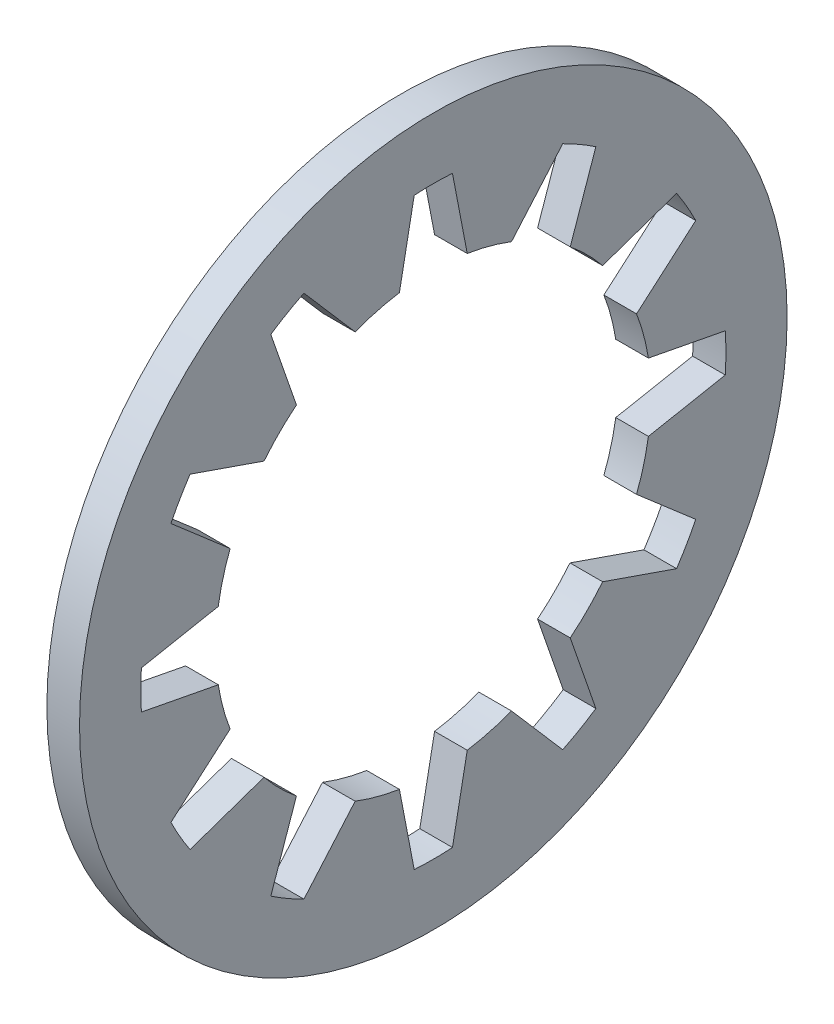
from build123d import *

# Parameters (mm, degrees)
SECSKE_W      = 1.2
SECSKE_H      = 5
INTCUT_DEPTH  = 19.423897525
INTCUTS_COUNT = 12
INTCUTS_ANGLE = 330


with BuildPart() as part:
    # SecSke → Body (revolve)
    with BuildSketch(Plane.XY):
        with Locations((-0.6, 10.5)):
            Rectangle(SECSKE_W, SECSKE_H)
    revolve(axis=Axis((-34.925, 0, 0), (1, 0, 0)))

    # IntCutSke → IntCut (cut, through all)
    with BuildSketch(Plane(origin=(0, 0, 0), x_dir=(0, 0, -1), z_dir=(1, 0, 0))):
        with BuildLine():
            Line((-0.703083639, 10.726983425), (-1.326257139, 7.483384395))
            ThreePointArc((-1.326257139, 7.483384395), (0, 7.6), (1.326257139, 7.483384395))
            Line((1.326257139, 7.483384395), (0.703083639, 10.726983425))
            ThreePointArc((0.703083639, 10.726983425), (0, 10.75), (-0.703083639, 10.726983425))
        make_face()
    intcut = extrude(amount=-INTCUT_DEPTH, mode=Mode.SUBTRACT)

    # IntCuts: IntCut ×12 about axis
    intcuts_axis = Axis((-34.925, 0, 0), (1, 0, 0))
    for i in range(1, INTCUTS_COUNT):
        add(intcut.rotate(intcuts_axis, i * INTCUTS_ANGLE / (INTCUTS_COUNT - 1)), mode=Mode.SUBTRACT)


solid = part.part
